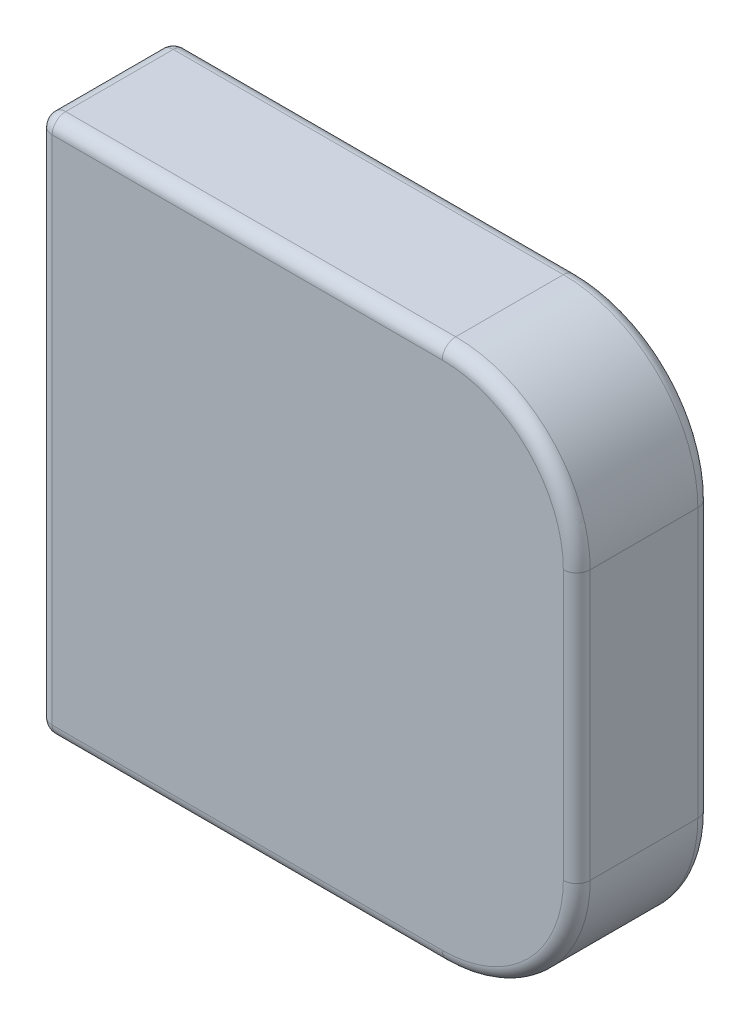
from build123d import *

# Parameters (mm, degrees)
SKETCH_1_W      = 40
SKETCH_1_H      = 40
EXTRUDE_1_DEPTH = 10
FILLET_1_R      = 10
FILLET_2_R      = 1


with BuildPart() as part:
    # 草图1 → 凸台-拉伸1 (new body)
    with BuildSketch(Plane.XY):
        Rectangle(SKETCH_1_W, SKETCH_1_H)
    extrude(amount=EXTRUDE_1_DEPTH)

    # 圆角1
    fillet_1_edges = [part.edges().sort_by_distance(p)[0] for p in [
        (20, -20, 5),
        (20, 20, 5),
    ]]
    fillet(fillet_1_edges, radius=FILLET_1_R)

    # 圆角2
    fillet_2_edges = [part.edges().sort_by_distance(p)[0] for p in [
        (-5, -20, 0),
        (-5, -20, 10),
        (-20, 0, 0),
        (-5, 20, 0),
        (-5, 20, 10),
        (-20, 0, 10),
        (-20, -20, 5),
        (-20, 20, 5),
        (17.071067812, -17.071067812, 0),
        (20, 0, 0),
        (17.071067812, 17.071067812, 0),
        (17.071067812, -17.071067812, 10),
        (20, 0, 10),
        (17.071067812, 17.071067812, 10),
    ]]
    fillet(fillet_2_edges, radius=FILLET_2_R)


solid = part.part
